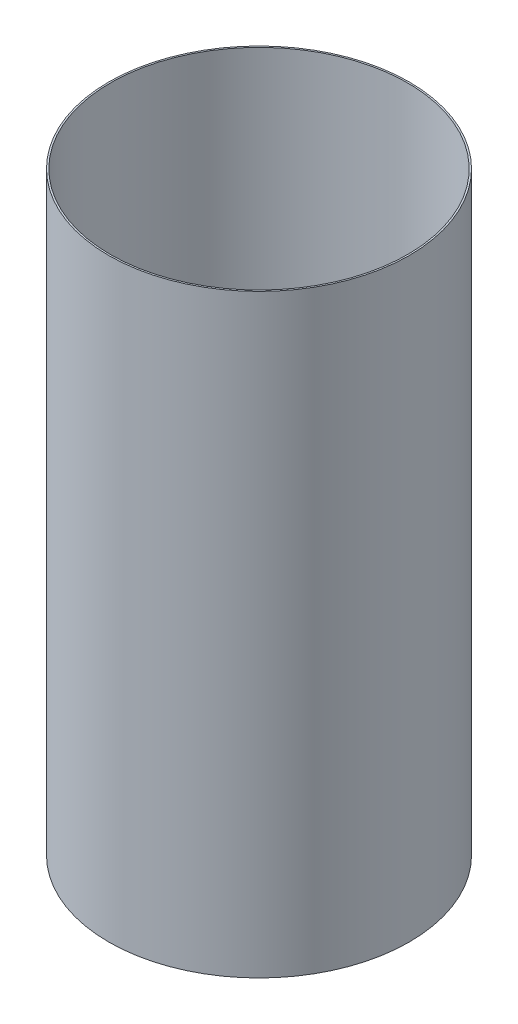
from build123d import *

# Parameters (mm, degrees)
SKETCH1_R           = 51.3588
SKETCH1_R_2         = 50.8
EXTRUDE_THIN1_DEPTH = 203.2


with BuildPart() as part:
    # Sketch1 → Extrude-Thin1 (new body)
    with BuildSketch(Plane(origin=(0, 0, 0), x_dir=(1, 0, 0), z_dir=(0, 1, 0))):
        Circle(SKETCH1_R)
        Circle(SKETCH1_R_2, mode=Mode.SUBTRACT)
    extrude(amount=EXTRUDE_THIN1_DEPTH)


solid = part.part
